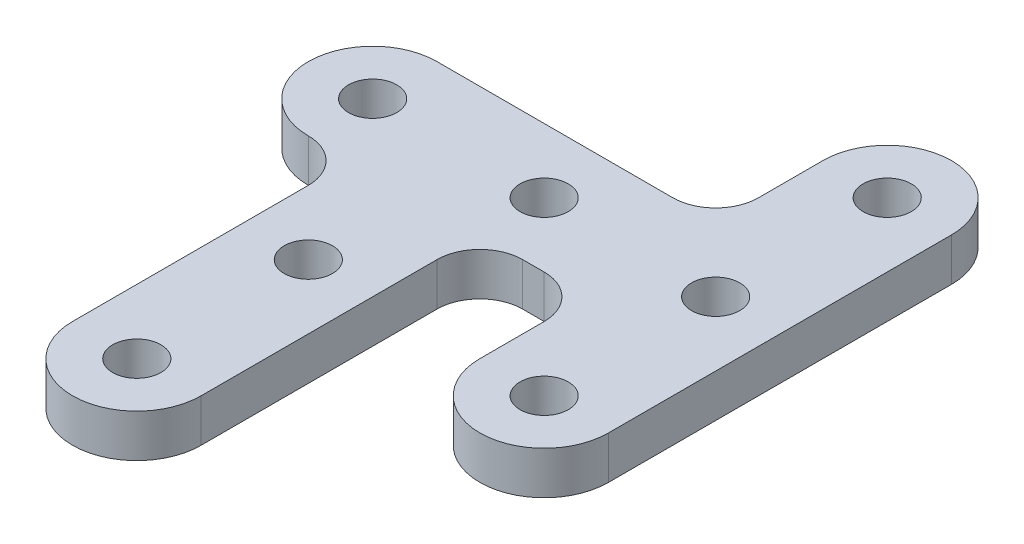
from build123d import *

# Parameters (mm, degrees)
BOSS_EXTRUDE2_START     = 12.827
BOSS_EXTRUDE2_DEPTH     = 6.35
F_1_4_CLEARANCE_HOLE2_D = 7.14248
FILLET2_R               = 6.35


with BuildPart() as part:
    # Sketch5 → Boss-Extrude2 (new body)
    with BuildSketch(Plane(origin=(0, 144.904574554, 0), x_dir=(-1, 0, 0), z_dir=(0, -1, 0)).offset(BOSS_EXTRUDE2_START)):
        with BuildLine():
            Line((-124.491812484, -1137.975334154), (-124.491812484, -1087.175334154))
            ThreePointArc((-124.491812484, -1087.175334154), (-114.966812484, -1077.650334154), (-105.441812484, -1087.175334154))
            Line((-105.441812484, -1087.175334154), (-105.441812484, -1103.050334154))
            Line((-105.441812484, -1103.050334154), (-64.166812484, -1103.050334154))
            ThreePointArc((-64.166812484, -1103.050334154), (-54.641812484, -1112.575334154), (-64.166812484, -1122.100334154))
            Line((-64.166812484, -1122.100334154), (-70.516812484, -1122.100334154))
            Line((-70.516812484, -1122.100334154), (-70.516812484, -1163.375334154))
            ThreePointArc((-70.516812484, -1163.375334154), (-80.041812484, -1172.900334154), (-89.566812484, -1163.375334154))
            Line((-89.566812484, -1163.375334154), (-89.566812484, -1122.100334154))
            Line((-89.566812484, -1122.100334154), (-105.441812484, -1122.100334154))
            Line((-105.441812484, -1122.100334154), (-105.441812484, -1137.975334154))
            ThreePointArc((-105.441812484, -1137.975334154), (-114.966812484, -1147.500334154), (-124.491812484, -1137.975334154))
        make_face()
    extrude(amount=BOSS_EXTRUDE2_DEPTH)

    # 1/4 Clearance Hole2 (through all)
    with Locations(Plane(origin=(0, 125.727574554, 0), x_dir=(-1, 0, 0), z_dir=(0, -1, 0))):
        with Locations((-114.966812484, -1087.175334154), (-114.966812484, -1137.975334154), (-114.966812484, -1112.575334154), (-89.566812484, -1112.575334154), (-64.166812484, -1112.575334154), (-80.041812484, -1137.975334154), (-80.041812484, -1163.375334154)):
            Hole(F_1_4_CLEARANCE_HOLE2_D / 2)

    # Fillet2
    fillet2_edges = [part.edges().sort_by_distance(p)[0] for p in [
        (105.441812484, 128.902574554, 1103.050334154),
        (70.516812484, 128.902574554, 1122.100334154),
        (89.566812484, 128.902574554, 1122.100334154),
        (105.441812484, 128.902574554, 1122.100334154),
    ]]
    fillet(fillet2_edges, radius=FILLET2_R - 0.0001)  # a hair under: the kernel refuses the full size


solid = part.part
